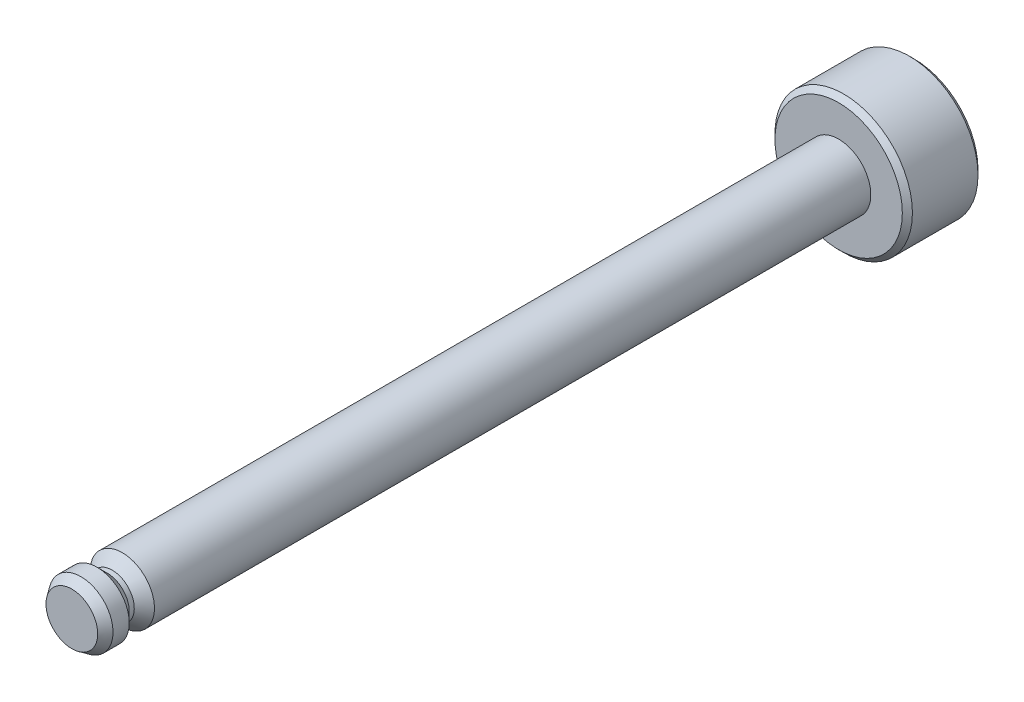
from build123d import *

# Parameters (mm, degrees)
SKETCH2_R      = 1.275
SHAFT_DEPTH    = 30.4
SKETCH5_R      = 2.725
HEAD_DEPTH     = 3
CHAMFER1_SIZE  = 0.25
CHAMFER1_SIZE2 = 0.357037002
DEBURS_SIZE    = 0.2


with BuildPart() as part:
    # Sketch2 → Shaft (new body)
    with BuildSketch(Plane.XY):
        Circle(SKETCH2_R)
    extrude(amount=SHAFT_DEPTH)

    # Sketch5 → Head (add)
    with BuildSketch(Plane.XY):
        Circle(SKETCH5_R)
    extrude(amount=-HEAD_DEPTH)

    # Chamfer1
    chamfer1_edges = [part.edges().sort_by_distance(p)[0] for p in [
        (-1.275, 0, 30.4),
    ]]
    chamfer1_side = [part.faces().sort_by_distance(p)[0] for p in [
        (0, 0, 30.4),
    ]]
    chamfer(chamfer1_edges, length=CHAMFER1_SIZE, length2=CHAMFER1_SIZE2, reference=chamfer1_side[0])

    # Deburs
    deburs_edges = [part.edges().sort_by_distance(p)[0] for p in [
        (-2.725, 0, 0),
        (-2.725, 0, -3),
    ]]
    chamfer(deburs_edges, length=DEBURS_SIZE)

    # Sketch6 → e-Clip Notch Long (revolve, cut)
    with BuildSketch(Plane(origin=(0, 0, 0), x_dir=(0, 0, -1), z_dir=(1, 0, 0))):
        Polygon((-29.4, 1.275), (-28.4, 1.275), (-28.8, 0.875), (-29, 0.875), align=None)
    revolve(axis=Axis((0, 0, 0), (0, 0, 1)), mode=Mode.SUBTRACT)


solid = part.part
